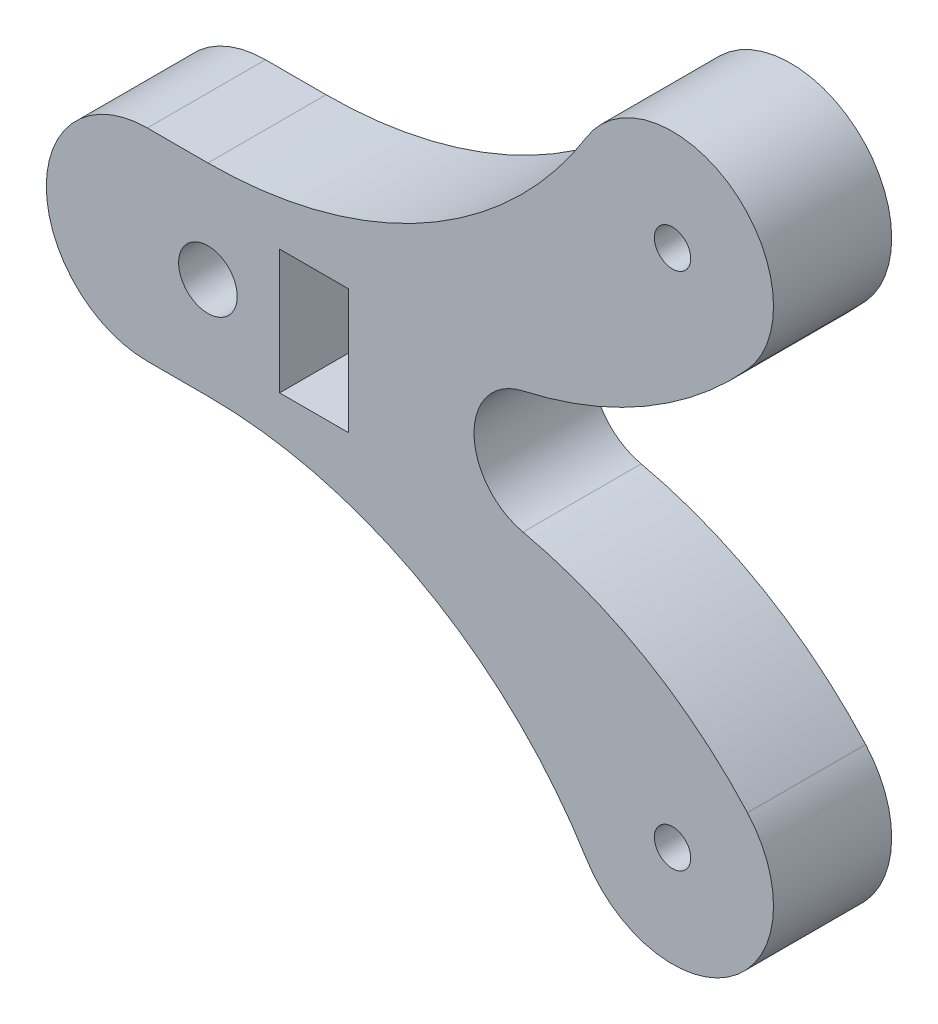
from build123d import *

# Parameters (mm, degrees)
SKETCH1_R           = 0.9
SKETCH1_R_2         = 1.449813
SKETCH1_W           = 3.400011
SKETCH1_H           = 6.165
BOSS_EXTRUDE1_DEPTH = 5.85


with BuildPart() as part:
    # Sketch1 → Boss-Extrude1 (new body)
    with BuildSketch(Plane.XY):
        with BuildLine():
            Line((588.919699582, 440.365819013), (585.919699582, 440.365819013))
            ThreePointArc((585.919699582, 440.365819013), (580.919699582, 435.365819013), (585.919699582, 430.365819013))
            Line((585.919699582, 430.365819013), (588.919699582, 430.365819013))
            ThreePointArc((588.919699582, 430.365819013), (599.644800818, 427.57533767), (607.649897061, 419.911590754))
            ThreePointArc((607.649897061, 419.911590754), (614.909236706, 418.505454086), (615.630430869, 425.864469739))
            ThreePointArc((615.630430869, 425.864469739), (610.57786824, 429.966507588), (604.517963856, 432.339830678))
            ThreePointArc((604.517963856, 432.339830678), (602.091309675, 435.365819013), (604.517963856, 438.391807349))
            ThreePointArc((604.517963856, 438.391807349), (610.57786824, 440.765130439), (615.630430869, 444.867168288))
            ThreePointArc((615.630430869, 444.867168288), (614.909236706, 452.226183941), (607.649897061, 450.820047273))
            ThreePointArc((607.649897061, 450.820047273), (599.644800818, 443.156300357), (588.919699582, 440.365819013))
        make_face()
        with Locations((611.919699582, 448.218358123)):
            Circle(SKETCH1_R, mode=Mode.SUBTRACT)
        with Locations((611.919699582, 422.513279903)):
            Circle(SKETCH1_R, mode=Mode.SUBTRACT)
        with Locations((588.919699582, 435.365819013)):
            Circle(SKETCH1_R_2, mode=Mode.SUBTRACT)
        with Locations((594.169518082, 435.365819013)):
            Rectangle(SKETCH1_W, SKETCH1_H, mode=Mode.SUBTRACT)
    extrude(amount=BOSS_EXTRUDE1_DEPTH)


solid = part.part
